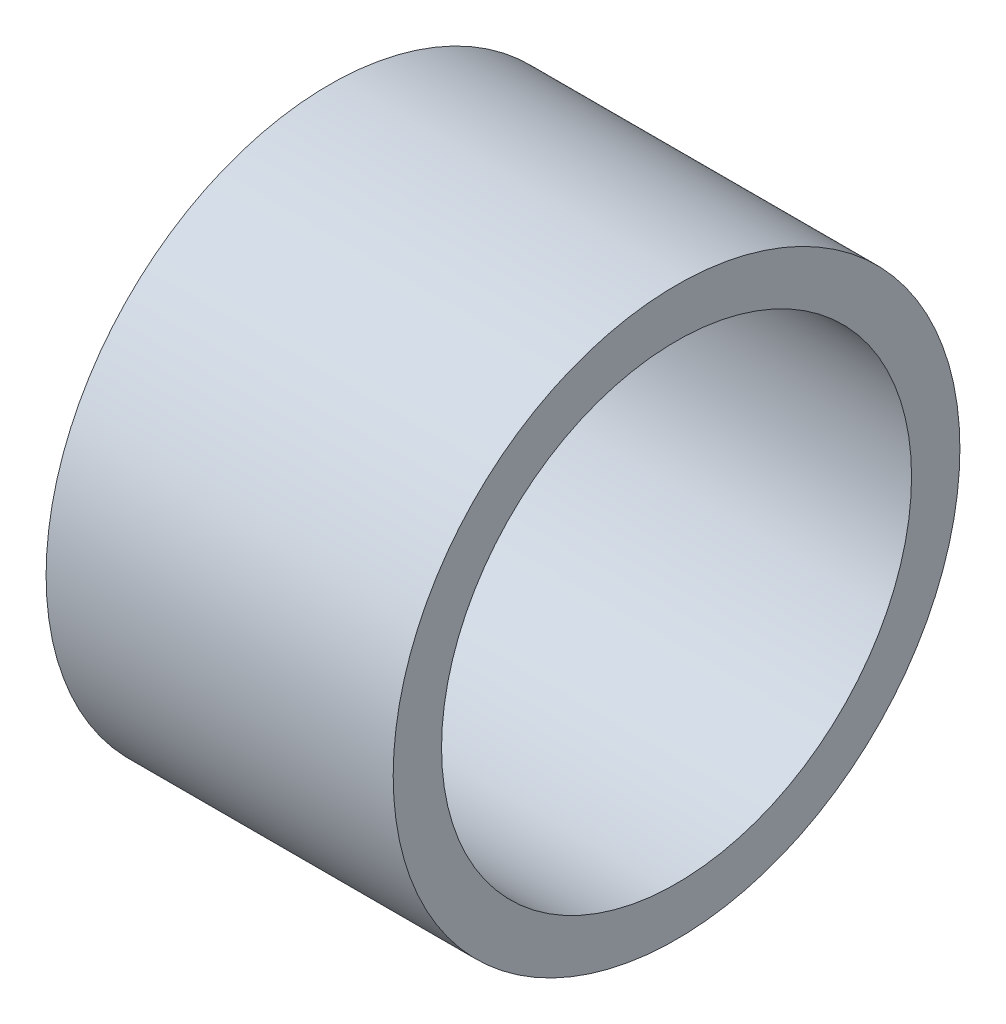
from build123d import *

# Parameters (mm, degrees)
ESQUISSE1_W = 24
ESQUISSE1_H = 3.343564854


with BuildPart() as part:
    # Esquisse1 → Révolution1 (revolve)
    with BuildSketch(Plane.XY):
        with Locations((94.977861083, -152.902195507)):
            Rectangle(ESQUISSE1_W, ESQUISSE1_H)
    revolve(axis=Axis((54.689735123, -170.823977934, 0), (1, 0, 0)))


solid = part.part
